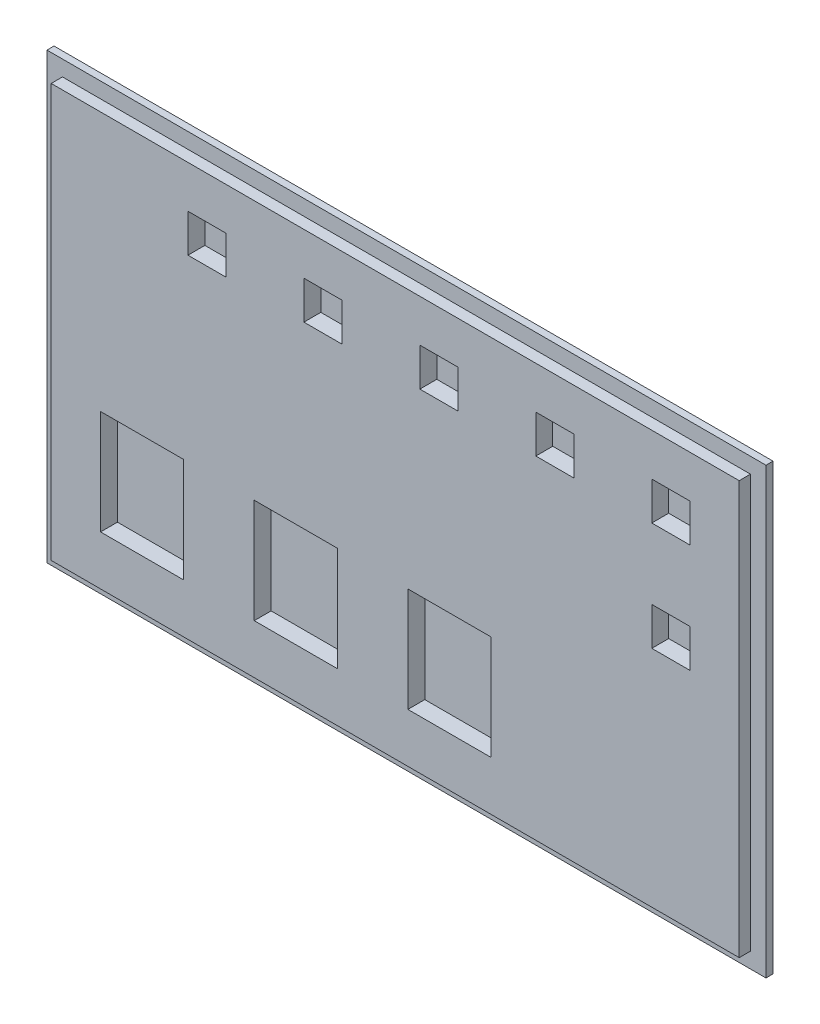
from build123d import *

# Parameters (mm, degrees)
SKICA1_W                = 97.6
SKICA1_H                = 58.6
SKICA1_W_2              = 11.8
SKICA1_H_2              = 14.8
SKICA1_W_3              = 5.4
SKICA1_H_3              = 5.4
P_IDAT_VYSUNUT_M1_DEPTH = 2.6
SKICA1_3_W              = 102
SKICA1_3_H              = 63
SKICA1_3_W_2            = 97.6
SKICA1_3_H_2            = 58.6
P_IDAT_VYSUNUT_M2_DEPTH = 1
SKICA1_5_W              = 5.4
SKICA1_5_H              = 5.4
SKICA1_5_W_2            = 11.8
SKICA1_5_H_2            = 14.8
P_IDAT_VYSUNUT_M3_DEPTH = 0.2


with BuildPart() as part:
    # Skica1 → Přidat vysunutím1 (new body)
    with BuildSketch(Plane.XY):
        with Locations((51, 31.5)):
            Rectangle(SKICA1_W, SKICA1_H)
        with Locations((15.1, 16.6)):
            Rectangle(SKICA1_W_2, SKICA1_H_2, mode=Mode.SUBTRACT)
        with Locations((36.9, 16.6)):
            Rectangle(SKICA1_W_2, SKICA1_H_2, mode=Mode.SUBTRACT)
        with Locations((58.7, 16.6)):
            Rectangle(SKICA1_W_2, SKICA1_H_2, mode=Mode.SUBTRACT)
        with Locations((24.3, 52.1)):
            Rectangle(SKICA1_W_3, SKICA1_H_3, mode=Mode.SUBTRACT)
        with Locations((40.75, 52.1)):
            Rectangle(SKICA1_W_3, SKICA1_H_3, mode=Mode.SUBTRACT)
        with Locations((90.1, 36.7)):
            Rectangle(SKICA1_W_3, SKICA1_H_3, mode=Mode.SUBTRACT)
        with Locations((57.2, 52.1)):
            Rectangle(SKICA1_W_3, SKICA1_H_3, mode=Mode.SUBTRACT)
        with Locations((73.65, 52.1)):
            Rectangle(SKICA1_W_3, SKICA1_H_3, mode=Mode.SUBTRACT)
        with Locations((90.1, 52.1)):
            Rectangle(SKICA1_W_3, SKICA1_H_3, mode=Mode.SUBTRACT)
    extrude(amount=P_IDAT_VYSUNUT_M1_DEPTH)

    # Skica1<3> → Přidat vysunutím2 (add)
    with BuildSketch(Plane.XY):
        with Locations((51, 31.5)):
            Rectangle(SKICA1_3_W, SKICA1_3_H)
        with Locations((51, 31.5)):
            Rectangle(SKICA1_3_W_2, SKICA1_3_H_2, mode=Mode.SUBTRACT)
    extrude(amount=P_IDAT_VYSUNUT_M2_DEPTH)

    # Skica1<5> → Přidat vysunutím3 (add)
    with BuildSketch(Plane.XY):
        with Locations((24.3, 52.1)):
            Rectangle(SKICA1_5_W, SKICA1_5_H)
        with Locations((40.75, 52.1)):
            Rectangle(SKICA1_5_W, SKICA1_5_H)
        with Locations((57.2, 52.1)):
            Rectangle(SKICA1_5_W, SKICA1_5_H)
        with Locations((73.65, 52.1)):
            Rectangle(SKICA1_5_W, SKICA1_5_H)
        with Locations((90.1, 52.1)):
            Rectangle(SKICA1_5_W, SKICA1_5_H)
        with Locations((15.1, 16.6)):
            Rectangle(SKICA1_5_W_2, SKICA1_5_H_2)
        with Locations((36.9, 16.6)):
            Rectangle(SKICA1_5_W_2, SKICA1_5_H_2)
        with Locations((58.7, 16.6)):
            Rectangle(SKICA1_5_W_2, SKICA1_5_H_2)
        with Locations((90.1, 36.7)):
            Rectangle(SKICA1_5_W, SKICA1_5_H)
    extrude(amount=P_IDAT_VYSUNUT_M3_DEPTH)


solid = part.part
